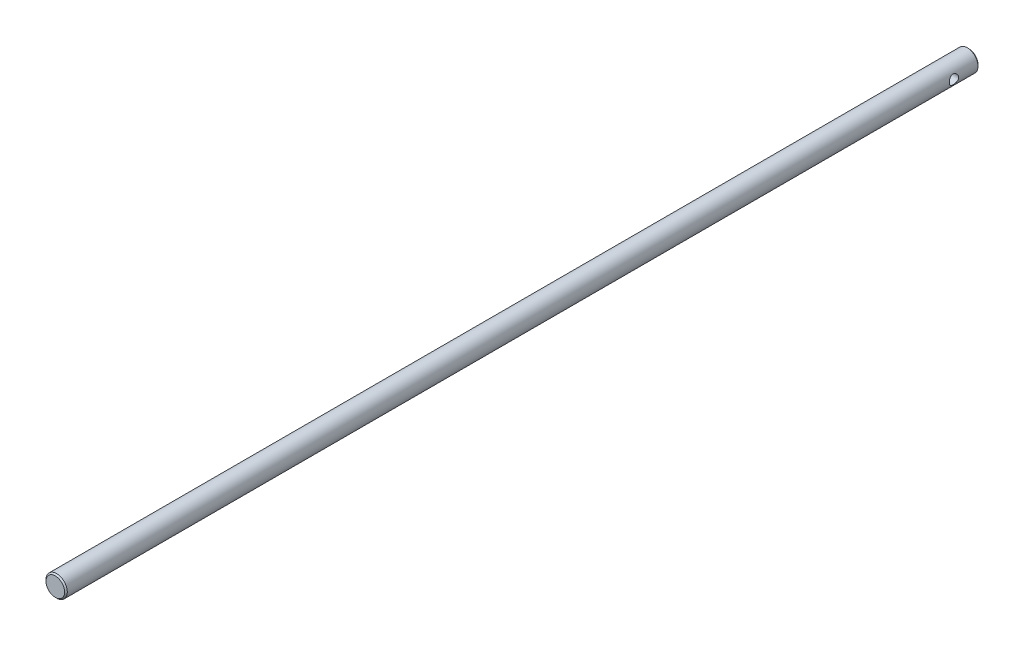
from build123d import *

# Parameters (mm, degrees)
SKETCH1_R           = 4
BOSS_EXTRUDE1_DEPTH = 342.9
CHAMFER1_SIZE       = 0.5
SKETCH3_R           = 1.7526
CUT_EXTRUDE1_DEPTH  = 344.01663225


with BuildPart() as part:
    # Sketch1 → Boss-Extrude1 (new body)
    with BuildSketch(Plane.XY):
        Circle(SKETCH1_R)
    extrude(amount=BOSS_EXTRUDE1_DEPTH)

    # Chamfer1
    chamfer1_edges = [part.edges().sort_by_distance(p)[0] for p in [
        (-4, 0, 0),
        (-4, 0, 342.9),
    ]]
    chamfer(chamfer1_edges, length=CHAMFER1_SIZE)

    # Sketch3 → Cut-Extrude1 (cut, through all)
    with BuildSketch(Plane.ZY.offset(4)):
        with Locations((9.525, 0)):
            Circle(SKETCH3_R)
    extrude(amount=-CUT_EXTRUDE1_DEPTH, mode=Mode.SUBTRACT)


solid = part.part
